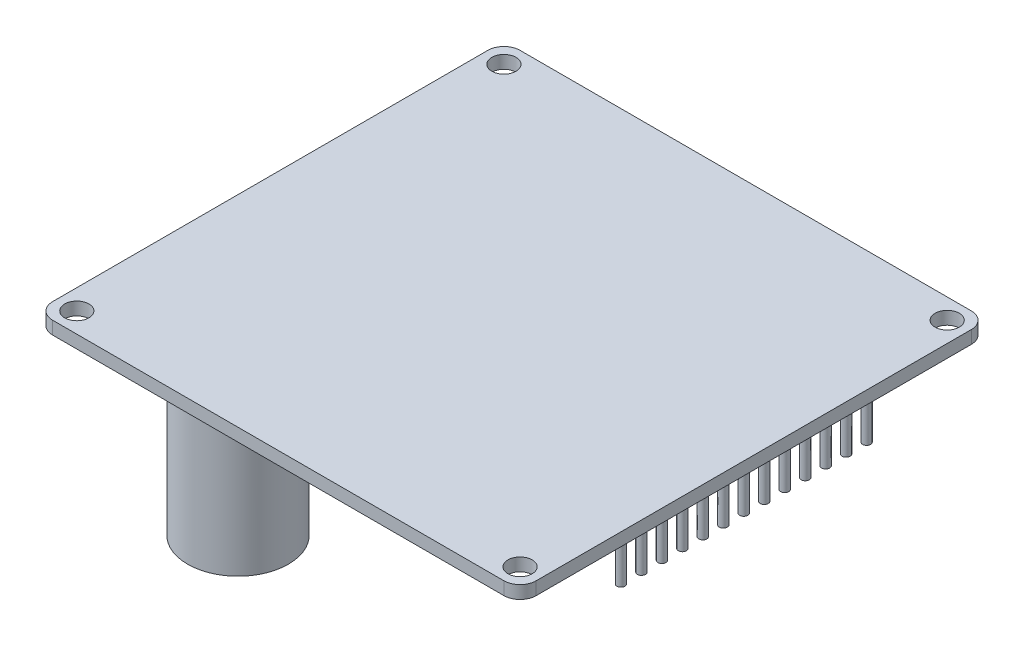
from build123d import *

# Parameters (mm, degrees)
SKETCH1_W             = 60
SKETCH1_H             = 58
BOSS_EXTRUDE1_DEPTH   = 1.6
FILLET1_R             = 2
SKETCH2_R             = 1.5
CUT_EXTRUDE1_DEPTH    = 1.6
SKETCH3_R             = 6.25
BOSS_EXTRUDE2_DEPTH   = 20
SKETCH4_W             = 5
SKETCH4_H             = 30
BOSS_EXTRUDE3_DEPTH   = 10
SKETCH5_W             = 2.54
SKETCH5_H             = 2.54
BOSS_EXTRUDE4_DEPTH   = 2
FILLET2_R             = 0.5
SKETCH6_R             = 0.5
BOSS_EXTRUDE5_DEPTH   = 7
LPATTERN1_START       = -2
LPATTERN1_DEPTH       = 2
LPATTERN1_START_2     = -9
LPATTERN1_2_OUTLINE_R = 0.5
LPATTERN1_2_DEPTH     = 7


# Read off the part's stored shape, not the designer's step: LPattern1
with BuildPart() as part:
    # Sketch1 → Boss-Extrude1 (new body)
    with BuildSketch(Plane(origin=(0, 0, 0), x_dir=(1, 0, 0), z_dir=(0, 1, 0))):
        Rectangle(SKETCH1_W, SKETCH1_H)
    extrude(amount=BOSS_EXTRUDE1_DEPTH)

    # Fillet1
    fillet1_edges = [part.edges().sort_by_distance(p)[0] for p in [
        (-30, 0.8, -29),
        (30, 0.8, -29),
        (30, 0.8, 29),
        (-30, 0.8, 29),
    ]]
    fillet(fillet1_edges, radius=FILLET1_R)

    # Sketch2 → Cut-Extrude1 (cut)
    with BuildSketch(Plane.XZ):
        with Locations(Location((-27.5, 26.5, 0), (0, 0, 270))):
            Circle(SKETCH2_R)
        with Locations(Location((-27.5, -26.5, 0), (0, 0, 90))):
            Circle(SKETCH2_R)
        with Locations(Location((27.5, -26.5, 0), (0, 0, 270))):
            Circle(SKETCH2_R)
        with Locations(Location((27.5, 26.5, 0), (0, 0, 90))):
            Circle(SKETCH2_R)
    extrude(amount=-CUT_EXTRUDE1_DEPTH, mode=Mode.SUBTRACT)

    # Sketch3 → Boss-Extrude2 (add)
    with BuildSketch(Plane.XZ):
        with Locations(Location((-15, 19, 0), (0, 0, 90))):
            Circle(SKETCH3_R)
    extrude(amount=BOSS_EXTRUDE2_DEPTH)

    # Sketch4 → Boss-Extrude3 (add)
    with BuildSketch(Plane.XZ):
        with Locations((-24, -1)):
            Rectangle(SKETCH4_W, SKETCH4_H)
    extrude(amount=BOSS_EXTRUDE3_DEPTH)

    # Sketch5 → Boss-Extrude4 (add)
    with BuildSketch(Plane.XZ):
        with Locations((25, -19)):
            Rectangle(SKETCH5_W, SKETCH5_H)
    extrude(amount=BOSS_EXTRUDE4_DEPTH)

    # Fillet2
    fillet2_edges = [part.edges().sort_by_distance(p)[0] for p in [
        (26.27, -1, -20.27),
        (26.27, -1, -17.73),
        (23.73, -1, -17.73),
        (23.73, -1, -20.27),
    ]]
    fillet(fillet2_edges, radius=FILLET2_R)

    # Sketch6 → Boss-Extrude5 (add)
    with BuildSketch(Plane.XZ.offset(2)):
        with Locations(Location((25, -19, 0), (0, 0, 90))):
            Circle(SKETCH6_R)
    extrude(amount=BOSS_EXTRUDE5_DEPTH)

    # LPattern1 outline → LPattern1 (add)
    with BuildSketch(Plane(origin=(0, 0, 0), x_dir=(1, 0, 0), z_dir=(0, 1, 0)).offset(LPATTERN1_START)):
        with BuildLine():
            Line((26.27, 15.69), (26.27, 17.23))
            ThreePointArc((26.27, 17.23), (26.123553391, 17.583553391), (25.77, 17.73))
            Line((25.77, 17.73), (24.23, 17.73))
            ThreePointArc((24.23, 17.73), (23.876446609, 17.583553391), (23.73, 17.23))
            Line((23.73, 17.23), (23.73, 15.69))
            ThreePointArc((23.73, 15.69), (23.876446609, 15.336446609), (24.23, 15.19))
            ThreePointArc((24.23, 15.19), (23.876446609, 15.043553391), (23.73, 14.69))
            Line((23.73, 14.69), (23.73, 13.15))
            ThreePointArc((23.73, 13.15), (23.876446609, 12.796446609), (24.23, 12.65))
            ThreePointArc((24.23, 12.65), (23.876446609, 12.503553391), (23.73, 12.15))
            Line((23.73, 12.15), (23.73, 10.61))
            ThreePointArc((23.73, 10.61), (23.876446609, 10.256446609), (24.23, 10.11))
            ThreePointArc((24.23, 10.11), (23.876446609, 9.963553391), (23.73, 9.61))
            Line((23.73, 9.61), (23.73, 8.07))
            ThreePointArc((23.73, 8.07), (23.876446609, 7.716446609), (24.23, 7.57))
            ThreePointArc((24.23, 7.57), (23.876446609, 7.423553391), (23.73, 7.07))
            Line((23.73, 7.07), (23.73, 5.53))
            ThreePointArc((23.73, 5.53), (23.876446609, 5.176446609), (24.23, 5.03))
            ThreePointArc((24.23, 5.03), (23.876446609, 4.883553391), (23.73, 4.53))
            Line((23.73, 4.53), (23.73, 2.99))
            ThreePointArc((23.73, 2.99), (23.876446609, 2.636446609), (24.23, 2.49))
            ThreePointArc((24.23, 2.49), (23.876446609, 2.343553391), (23.73, 1.99))
            Line((23.73, 1.99), (23.73, 0.45))
            ThreePointArc((23.73, 0.45), (23.876446609, 0.096446609), (24.23, -0.05))
            ThreePointArc((24.23, -0.05), (23.876446609, -0.196446609), (23.73, -0.55))
            Line((23.73, -0.55), (23.73, -2.09))
            ThreePointArc((23.73, -2.09), (23.876446609, -2.443553391), (24.23, -2.59))
            ThreePointArc((24.23, -2.59), (23.876446609, -2.736446609), (23.73, -3.09))
            Line((23.73, -3.09), (23.73, -4.63))
            ThreePointArc((23.73, -4.63), (23.876446609, -4.983553391), (24.23, -5.13))
            ThreePointArc((24.23, -5.13), (23.876446609, -5.276446609), (23.73, -5.63))
            Line((23.73, -5.63), (23.73, -7.17))
            ThreePointArc((23.73, -7.17), (23.876446609, -7.523553391), (24.23, -7.67))
            ThreePointArc((24.23, -7.67), (23.876446609, -7.816446609), (23.73, -8.17))
            Line((23.73, -8.17), (23.73, -9.71))
            ThreePointArc((23.73, -9.71), (23.876446609, -10.063553391), (24.23, -10.21))
            ThreePointArc((24.23, -10.21), (23.876446609, -10.356446609), (23.73, -10.71))
            Line((23.73, -10.71), (23.73, -12.25))
            ThreePointArc((23.73, -12.25), (23.876446609, -12.603553391), (24.23, -12.75))
            Line((24.23, -12.75), (25.77, -12.75))
            ThreePointArc((25.77, -12.75), (26.123553391, -12.603553391), (26.27, -12.25))
            Line((26.27, -12.25), (26.27, -10.71))
            ThreePointArc((26.27, -10.71), (26.123553391, -10.356446609), (25.77, -10.21))
            ThreePointArc((25.77, -10.21), (26.123553391, -10.063553391), (26.27, -9.71))
            Line((26.27, -9.71), (26.27, -8.17))
            ThreePointArc((26.27, -8.17), (26.123553391, -7.816446609), (25.77, -7.67))
            ThreePointArc((25.77, -7.67), (26.123553391, -7.523553391), (26.27, -7.17))
            Line((26.27, -7.17), (26.27, -5.63))
            ThreePointArc((26.27, -5.63), (26.123553391, -5.276446609), (25.77, -5.13))
            ThreePointArc((25.77, -5.13), (26.123553391, -4.983553391), (26.27, -4.63))
            Line((26.27, -4.63), (26.27, -3.09))
            ThreePointArc((26.27, -3.09), (26.123553391, -2.736446609), (25.77, -2.59))
            ThreePointArc((25.77, -2.59), (26.123553391, -2.443553391), (26.27, -2.09))
            Line((26.27, -2.09), (26.27, -0.55))
            ThreePointArc((26.27, -0.55), (26.123553391, -0.196446609), (25.77, -0.05))
            ThreePointArc((25.77, -0.05), (26.123553391, 0.096446609), (26.27, 0.45))
            Line((26.27, 0.45), (26.27, 1.99))
            ThreePointArc((26.27, 1.99), (26.123553391, 2.343553391), (25.77, 2.49))
            ThreePointArc((25.77, 2.49), (26.123553391, 2.636446609), (26.27, 2.99))
            Line((26.27, 2.99), (26.27, 4.53))
            ThreePointArc((26.27, 4.53), (26.123553391, 4.883553391), (25.77, 5.03))
            ThreePointArc((25.77, 5.03), (26.123553391, 5.176446609), (26.27, 5.53))
            Line((26.27, 5.53), (26.27, 7.07))
            ThreePointArc((26.27, 7.07), (26.123553391, 7.423553391), (25.77, 7.57))
            ThreePointArc((25.77, 7.57), (26.123553391, 7.716446609), (26.27, 8.07))
            Line((26.27, 8.07), (26.27, 9.61))
            ThreePointArc((26.27, 9.61), (26.123553391, 9.963553391), (25.77, 10.11))
            ThreePointArc((25.77, 10.11), (26.123553391, 10.256446609), (26.27, 10.61))
            Line((26.27, 10.61), (26.27, 12.15))
            ThreePointArc((26.27, 12.15), (26.123553391, 12.503553391), (25.77, 12.65))
            ThreePointArc((25.77, 12.65), (26.123553391, 12.796446609), (26.27, 13.15))
            Line((26.27, 13.15), (26.27, 14.69))
            ThreePointArc((26.27, 14.69), (26.123553391, 15.043553391), (25.77, 15.19))
            ThreePointArc((25.77, 15.19), (26.123553391, 15.336446609), (26.27, 15.69))
        make_face()
    extrude(amount=LPATTERN1_DEPTH)

    # LPattern1 2 outline → LPattern1 2 (add)
    with BuildSketch(Plane(origin=(0, 0, 0), x_dir=(1, 0, 0), z_dir=(0, 1, 0)).offset(LPATTERN1_START_2)):
        with Locations((25, 16.46)):
            Circle(LPATTERN1_2_OUTLINE_R)
        with Locations((25, 13.92)):
            Circle(LPATTERN1_2_OUTLINE_R)
        with Locations((25, 11.38)):
            Circle(LPATTERN1_2_OUTLINE_R)
        with Locations((25, 8.84)):
            Circle(LPATTERN1_2_OUTLINE_R)
        with Locations((25, 6.3)):
            Circle(LPATTERN1_2_OUTLINE_R)
        with Locations((25, 3.76)):
            Circle(LPATTERN1_2_OUTLINE_R)
        with Locations((25, 1.22)):
            Circle(LPATTERN1_2_OUTLINE_R)
        with Locations((25, -1.32)):
            Circle(LPATTERN1_2_OUTLINE_R)
        with Locations((25, -3.86)):
            Circle(LPATTERN1_2_OUTLINE_R)
        with Locations((25, -6.4)):
            Circle(LPATTERN1_2_OUTLINE_R)
        with Locations((25, -8.94)):
            Circle(LPATTERN1_2_OUTLINE_R)
        with Locations((25, -11.48)):
            Circle(LPATTERN1_2_OUTLINE_R)
    extrude(amount=LPATTERN1_2_DEPTH)


solid = part.part
